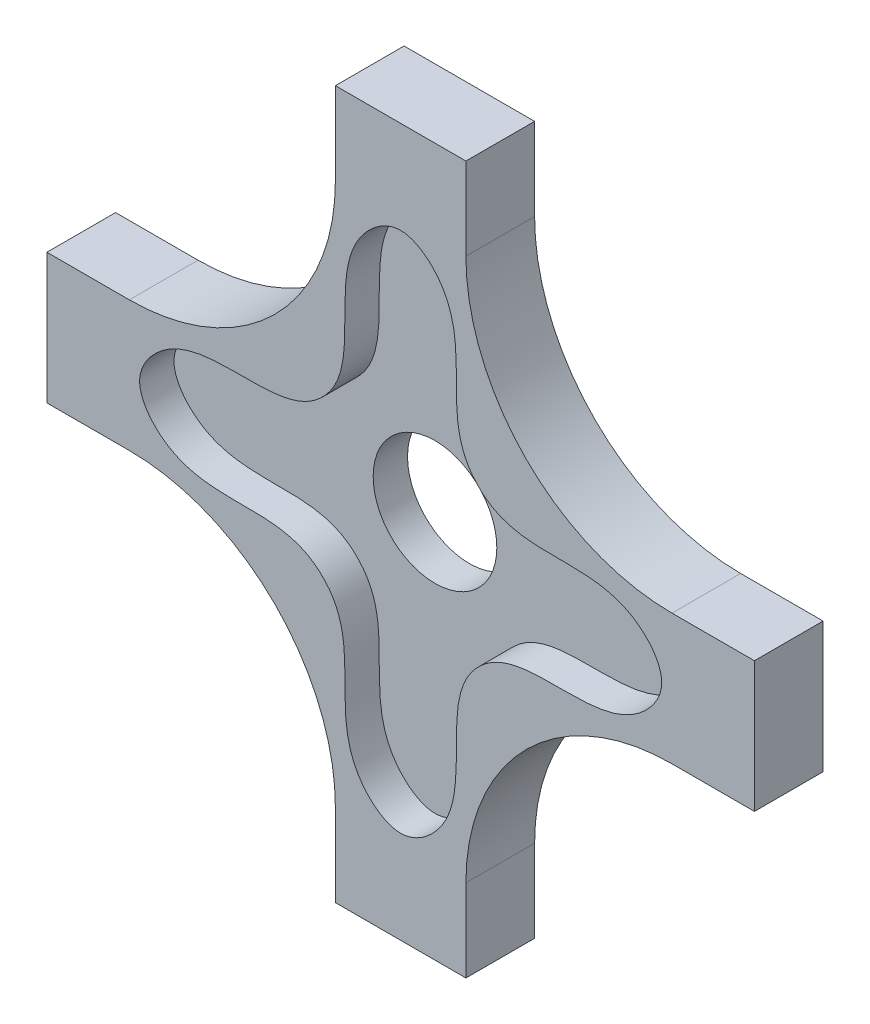
from build123d import *

# Parameters (mm, degrees)
BOSS_EXTRUDE1_DEPTH = 5
CUT_EXTRUDE1_DEPTH  = 2.5
SKETCH3_R           = 4.5
CUT_EXTRUDE2_DEPTH  = 37.757652418


with BuildPart() as part:
    # Sketch1 → Boss-Extrude1 (new body)
    with BuildSketch(Plane.XY):
        with BuildLine():
            Line((-4.75, -19.75), (-4.75, -25.75))
            Line((-4.75, -25.75), (4.75, -25.75))
            Line((4.75, -25.75), (4.75, -19.75))
            ThreePointArc((4.75, -19.75), (9.143398282, -9.143398282), (19.75, -4.75))
            Line((19.75, -4.75), (25.75, -4.75))
            Line((25.75, -4.75), (25.75, 4.75))
            Line((25.75, 4.75), (19.75, 4.75))
            ThreePointArc((19.75, 4.75), (9.143398282, 9.143398282), (4.75, 19.75))
            Line((4.75, 19.75), (4.75, 25.75))
            Line((4.75, 25.75), (-4.75, 25.75))
            Line((-4.75, 25.75), (-4.75, 19.75))
            ThreePointArc((-4.75, 19.75), (-9.143398282, 9.143398282), (-19.75, 4.75))
            Line((-19.75, 4.75), (-25.75, 4.75))
            Line((-25.75, 4.75), (-25.75, -4.75))
            Line((-25.75, -4.75), (-19.75, -4.75))
            ThreePointArc((-19.75, -4.75), (-9.143398282, -9.143398282), (-4.75, -19.75))
        make_face()
    extrude(amount=BOSS_EXTRUDE1_DEPTH)

    # Sketch2 → Cut-Extrude1 (cut)
    with BuildSketch(Plane.XY.offset(5)):
        with BuildLine():
            add(Edge.make_bspline(
                [(0, 19), (1.152825325, 19), (5.723240465, 15.306744246), (2.69640121, 8.595203145), (8.595203145, 2.69640121), (15.306744246, 5.723240465), (19.931573749, 0), (15.306744246, -5.723240465), (8.595203145, -2.69640121), (2.69640121, -8.595203145), (5.723240465, -15.306744246), (0, -19.931573749), (-5.723240465, -15.306744246), (-2.69640121, -8.595203145), (-8.595203145, -2.69640121), (-15.306744246, -5.723240465), (-19.931573749, 0), (-15.306744246, 5.723240465), (-8.595203145, 2.69640121), (-2.69640121, 8.595203145), (-5.723240465, 15.306744246), (-1.152825325, 19), (0, 19)],
                knots=[0, 0, 0, 0, 0.029351624, 0.116365509, 0.133634491, 0.220648376, 0.25, 0.279351624, 0.366365509, 0.383634491, 0.470648376, 0.5, 0.529351624, 0.616365509, 0.633634491, 0.720648376, 0.75, 0.779351624, 0.866365509, 0.883634491, 0.970648376, 1, 1, 1, 1], degree=3))
        make_face()
    extrude(amount=-CUT_EXTRUDE1_DEPTH, mode=Mode.SUBTRACT)

    # Sketch3 → Cut-Extrude2 (cut, through all)
    with BuildSketch(Plane(origin=(0, 0, 0), x_dir=(-1, 0, 0), z_dir=(0, 0, -1))):
        Circle(SKETCH3_R)
    extrude(amount=-CUT_EXTRUDE2_DEPTH, mode=Mode.SUBTRACT)


solid = part.part
